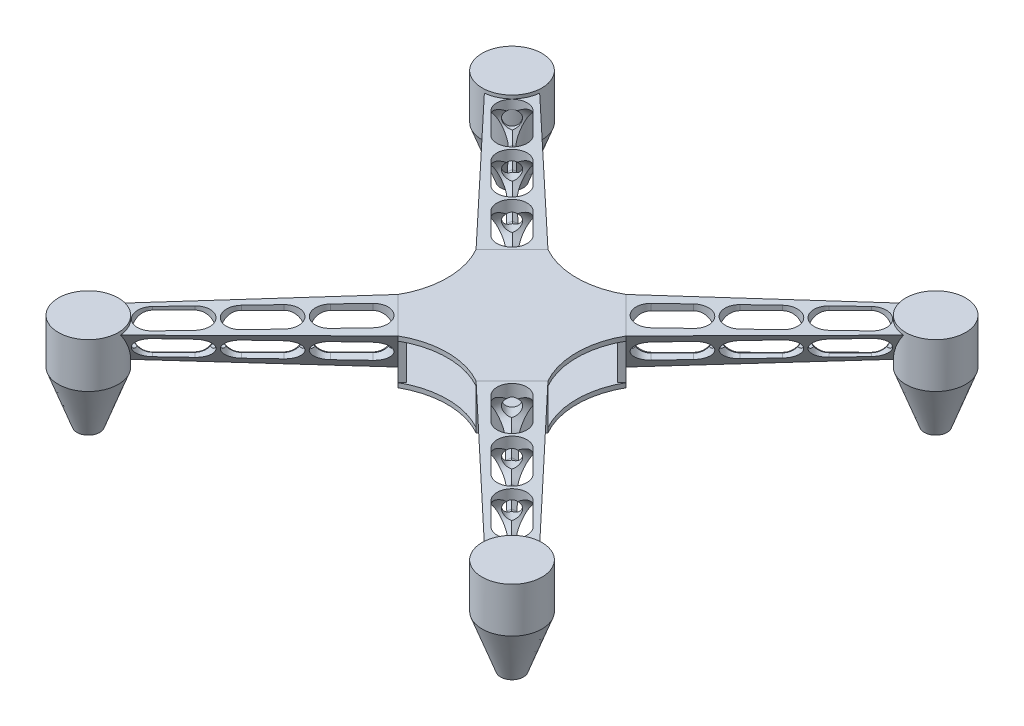
from build123d import *

# Parameters (mm, degrees)
CROQUIS1_R                        = 10
SALIENTE_EXTRUIR1_DEPTH           = 15
CROQUIS1_W                        = 50
CROQUIS1_H                        = 50
SALIENTE_EXTRUIR1_2_DEPTH         = 15
CROQUIS4_W                        = 45
CROQUIS4_H                        = 12
CORTAR_EXTRUIR1_DEPTH             = 200
CROQUIS5_W                        = 45
CROQUIS5_H                        = 12
CORTAR_EXTRUIR2_DEPTH             = 200
CORTAR_EXTRUIR5_DEPTH             = 100
CROQUIS7_W                        = 16.970562748
CROQUIS7_H                        = 15
SALIENTE_EXTRUIR2_DEPTH           = 2
CROQUIS8_W                        = 16.970562748
CROQUIS8_H                        = 15
SALIENTE_EXTRUIR3_DEPTH           = 2
CROQUIS9_W                        = 16.970562748
CROQUIS9_H                        = 15
SALIENTE_EXTRUIR4_DEPTH           = 2
CROQUIS10_W                       = 16.970562748
CROQUIS10_H                       = 15
SALIENTE_EXTRUIR5_DEPTH           = 2
SALIENTE_EXTRUIR6_DEPTH           = 75
SALIENTE_EXTRUIR6_TAPER           = 1
CORTAR_EXTRUIR8_DEPTH             = 5
CORTAR_EXTRUIR9_DEPTH             = 5
CORTAR_EXTRUIR10_DEPTH            = 5
CROQUIS24_R                       = 2.5
CORTAR_EXTRUIR11_DEPTH            = 115
MATRIZC2_COUNT                    = 4
CROQUIS17_R                       = 10
SALIENTE_EXTRUIR7_DEPTH           = 15
CORTAR_EXTRUIR12_DEPTH            = 100
CROQUIS29_R                       = 10
SALIENTE_EXTRUIR9_DEPTH           = 17
SALIENTE_EXTRUIR9_DRAFT           = 20
SALIENTE_EXTRUIR9_PROFILE_2_DEPTH = 17
SALIENTE_EXTRUIR9_PROFILE_2_DRAFT = 20
SALIENTE_EXTRUIR9_PROFILE_3_DEPTH = 17
SALIENTE_EXTRUIR9_PROFILE_3_DRAFT = 20
SALIENTE_EXTRUIR9_PROFILE_4_DEPTH = 17
SALIENTE_EXTRUIR9_PROFILE_4_DRAFT = 20


with BuildPart() as part:
    # Croquis1 → Saliente-Extruir1 (new body)
    with BuildSketch(Plane(origin=(0, 0, 0), x_dir=(1, 0, 0), z_dir=(0, 1, 0))):
        with Locations(Location((-70.710678119, 70.710678119, 0), (0, 0, 270))):
            Circle(CROQUIS1_R)
    extrude(amount=SALIENTE_EXTRUIR1_DEPTH)



with BuildPart() as body_2:
    # Croquis1 → Saliente-Extruir1 2 (new body)
    with BuildSketch(Plane(origin=(0, 0, 0), x_dir=(1, 0, 0), z_dir=(0, 1, 0))):
        Rectangle(CROQUIS1_W, CROQUIS1_H)
    extrude(amount=SALIENTE_EXTRUIR1_2_DEPTH)

    # Croquis4 → Cortar-Extruir1 (cut)
    with BuildSketch(Plane(origin=(25, 0, 0), x_dir=(0, 0, -1), z_dir=(1, 0, 0))):
        with Locations((0, 7.5)):
            Rectangle(CROQUIS4_W, CROQUIS4_H)
    extrude(amount=-CORTAR_EXTRUIR1_DEPTH, mode=Mode.SUBTRACT)

    # Croquis5 → Cortar-Extruir2 (cut)
    with BuildSketch(Plane(origin=(0, 0, -25), x_dir=(-1, 0, 0), z_dir=(0, 0, -1))):
        with Locations((0, 7.5)):
            Rectangle(CROQUIS5_W, CROQUIS5_H)
    extrude(amount=-CORTAR_EXTRUIR2_DEPTH, mode=Mode.SUBTRACT)

    # Croquis6 → Cortar-Extruir5 (cut, symmetric)
    with BuildSketch(Plane(origin=(0, 1.5, 0), x_dir=(1, 0, 0), z_dir=(0, 1, 0))):
        Polygon((-25, 13), (-13, 25), (-25, 25), align=None)
        Polygon((25, -25), (25, -13), (13, -25), align=None)
        Polygon((25, 25), (13, 25), (25, 13), align=None)
        Polygon((-25, -25), (-25, -13), (-13, -25), align=None)
    extrude(amount=CORTAR_EXTRUIR5_DEPTH, both=True, mode=Mode.SUBTRACT)


with BuildPart() as cortar_extruir5_piece_1:
    # of the separate pieces the step leaves, piece 1, a body of its own (cortar_extruir5_pieces)
    add(body_2.part.solids().sort_by_distance((-13, 0, 25))[0])



with BuildPart() as cortar_extruir5_piece_2:
    # of the separate pieces the step leaves, piece 2, a body of its own (cortar_extruir5_pieces)
    add(body_2.part.solids().sort_by_distance((-13, 13.5, 25))[0])


with BuildPart() as cortar_extruir5_piece_1_1:
    add(cortar_extruir5_piece_1.part)

    add(cortar_extruir5_piece_2.part)  # Saliente-Extruir2 merges Cortar-Extruir5 piece 2
    # Croquis7 → Saliente-Extruir2 (add)
    with BuildSketch(Plane(origin=(19, 0, 19), x_dir=(0.7071067811865475, 0, -0.7071067811865477), z_dir=(0.7071067811865477, 0, 0.7071067811865475))):
        with Locations((0, 7.5)):
            Rectangle(CROQUIS7_W, CROQUIS7_H)
    extrude(amount=-SALIENTE_EXTRUIR2_DEPTH)

    # Croquis8 → Saliente-Extruir3 (add)
    with BuildSketch(Plane(origin=(19, 0, -19), x_dir=(-0.7071067811865472, 0, -0.7071067811865478), z_dir=(0.7071067811865478, 0, -0.7071067811865472))):
        with Locations((0, 7.5)):
            Rectangle(CROQUIS8_W, CROQUIS8_H)
    extrude(amount=-SALIENTE_EXTRUIR3_DEPTH)

    # Croquis9 → Saliente-Extruir4 (add)
    with BuildSketch(Plane(origin=(-19, 0, -19), x_dir=(-0.7071067811865475, 0, 0.7071067811865477), z_dir=(-0.7071067811865477, 0, -0.7071067811865475))):
        with Locations((0, 7.5)):
            Rectangle(CROQUIS9_W, CROQUIS9_H)
    extrude(amount=-SALIENTE_EXTRUIR4_DEPTH)

    # Croquis10 → Saliente-Extruir5 (add)
    with BuildSketch(Plane(origin=(-19, 0, 19), x_dir=(0.7071067811865475, 0, 0.7071067811865477), z_dir=(-0.7071067811865477, 0, 0.7071067811865475))):
        with Locations((0, 7.5)):
            Rectangle(CROQUIS10_W, CROQUIS10_H)
    extrude(amount=-SALIENTE_EXTRUIR5_DEPTH)


with BuildPart() as part_1:
    add(part.part)

    add(cortar_extruir5_piece_1_1.part)  # Saliente-Extruir6 merges Cortar-Extruir5 piece 1
    # Croquis11 → Saliente-Extruir6 (add)
    with BuildSketch(Plane(origin=(-19, 0, -19), x_dir=(-0.7071067811865475, 0, 0.7071067811865477), z_dir=(-0.7071067811865477, 0, -0.7071067811865475))):
        Polygon((0, 0), (8.485281374, 15), (-8.485281374, 15), align=None)
    saliente_extruir6 = extrude(amount=SALIENTE_EXTRUIR6_DEPTH, taper=SALIENTE_EXTRUIR6_TAPER)

    # Croquis20 → Cortar-Extruir8 (cut)
    with BuildSketch(Plane(origin=(-0.294360216, -0.230858458, 0.282785929), x_dir=(0.47450033804172476, 0.3721373014234886, 0.7977237981203348), z_dir=(-0.6277044326850748, -0.4922909741961972, 0.6030230028054215))):
        with BuildLine():
            Line((-46.905659661, 26.722264388), (-55.90301314, 31.08662349))
            ThreePointArc((-55.90301314, 31.08662349), (-58.219510329, 37.76747978), (-51.538654038, 40.083976969))
            Line((-51.538654038, 40.083976969), (-42.541300559, 35.719617867))
            ThreePointArc((-42.541300559, 35.719617867), (-40.224803371, 29.038761576), (-46.905659661, 26.722264388))
        make_face()
        with BuildLine():
            Line((-65.780334633, 35.92805847), (-74.777688113, 40.292417572))
            ThreePointArc((-74.777688113, 40.292417572), (-77.094185301, 46.973273863), (-70.413329011, 49.289771051))
            Line((-70.413329011, 49.289771051), (-61.415975531, 44.92541195))
            ThreePointArc((-61.415975531, 44.92541195), (-59.099478343, 38.244555659), (-65.780334633, 35.92805847))
        make_face()
        with BuildLine():
            Line((-28.030984689, 17.516470305), (-37.028338168, 21.880829407))
            ThreePointArc((-37.028338168, 21.880829407), (-39.344835357, 28.561685698), (-32.663979066, 30.878182886))
            Line((-32.663979066, 30.878182886), (-23.666625587, 26.513823784))
            ThreePointArc((-23.666625587, 26.513823784), (-21.350128398, 19.832967494), (-28.030984689, 17.516470305))
        make_face()
    cortar_extruir8 = extrude(amount=-CORTAR_EXTRUIR8_DEPTH, mode=Mode.SUBTRACT)

    # Croquis21 → Cortar-Extruir9 (cut)
    with BuildSketch(Plane(origin=(0.282785929, -0.230858458, -0.294360216), x_dir=(-0.7977237981203357, -0.3721373014234891, -0.47450033804172287), z_dir=(0.6030230028054204, -0.49229097419619955, -0.6277044326850743))):
        with BuildLine():
            Line((36.989503564, 21.962448925), (27.992150085, 17.598089824))
            ThreePointArc((27.992150085, 17.598089824), (21.311293794, 19.914587012), (23.627790983, 26.595443303))
            Line((23.627790983, 26.595443303), (32.625144462, 30.959802405))
            ThreePointArc((32.625144462, 30.959802405), (39.306000753, 28.643305216), (36.989503564, 21.962448925))
        make_face()
        with BuildLine():
            Line((55.864138803, 31.168223629), (46.866785324, 26.803864527))
            ThreePointArc((46.866785324, 26.803864527), (40.185929034, 29.120361716), (42.502426222, 35.801218006))
            Line((42.502426222, 35.801218006), (51.499779701, 40.165577108))
            ThreePointArc((51.499779701, 40.165577108), (58.180635992, 37.84907992), (55.864138803, 31.168223629))
        make_face()
        with BuildLine():
            Line((74.738774043, 40.373998333), (65.741420564, 36.009639231))
            ThreePointArc((65.741420564, 36.009639231), (59.060564273, 38.326136419), (61.377061462, 45.00699271))
            Line((61.377061462, 45.00699271), (70.374414941, 49.371351812))
            ThreePointArc((70.374414941, 49.371351812), (77.055271231, 47.054854623), (74.738774043, 40.373998333))
        make_face()
    cortar_extruir9 = extrude(amount=-CORTAR_EXTRUIR9_DEPTH, mode=Mode.SUBTRACT)

    # Croquis22 → Cortar-Extruir10 (cut)
    with BuildSketch(Plane(origin=(-0.190869674, 15.464306947, -0.190869674), x_dir=(0.9999238504780121, 0.012339775057140063, -0.00015230484316707172), z_dir=(-0.012340714939826953, 0.9998476951563913, -0.012340714939826948))):
        with BuildLine():
            Line((-26.58868346, 19.521127269), (-33.659212731, 26.59273358))
            ThreePointArc((-33.659212731, 26.59273358), (-33.658674211, 33.663801371), (-26.58760642, 33.663262851))
            Line((-26.58760642, 33.663262851), (-19.517077148, 26.59165654))
            ThreePointArc((-19.517077148, 26.59165654), (-19.517615668, 19.520588749), (-26.58868346, 19.521127269))
        make_face()
        with BuildLine():
            Line((-34.366319559, 41.440898951), (-41.436848831, 48.512505262))
            ThreePointArc((-41.436848831, 48.512505262), (-48.507916622, 48.513043782), (-48.508455142, 41.441975991))
            Line((-48.508455142, 41.441975991), (-41.437925871, 34.37036968))
            ThreePointArc((-41.437925871, 34.37036968), (-34.366858079, 34.36983116), (-34.366319559, 41.440898951))
        make_face()
        with BuildLine():
            Line((-49.215561971, 56.290141362), (-56.286091242, 63.361747673))
            ThreePointArc((-56.286091242, 63.361747673), (-63.357159033, 63.362286193), (-63.357697553, 56.291218402))
            Line((-63.357697553, 56.291218402), (-56.287168282, 49.219612091))
            ThreePointArc((-56.287168282, 49.219612091), (-49.21610049, 49.219073571), (-49.215561971, 56.290141362))
        make_face()
    cortar_extruir10 = extrude(amount=-CORTAR_EXTRUIR10_DEPTH, mode=Mode.SUBTRACT)

    # Croquis24 → Cortar-Extruir11 (cut)
    with BuildSketch(Plane(origin=(-17.585786438, 0, -17.585786438), x_dir=(0.7071067811865474, 0, -0.7071067811865477), z_dir=(0.7071067811865477, 0, 0.7071067811865474))):
        with Locations(Location((0, 8.5, 0), (0, 0, 59.530931729))):
            Circle(CROQUIS24_R)
    cortar_extruir11 = extrude(amount=-CORTAR_EXTRUIR11_DEPTH, mode=Mode.SUBTRACT)

    # MatrizC2: Saliente-Extruir6, Cortar-Extruir8, Cortar-Extruir9, Cortar-Extruir10, Cortar-Extruir11 ×4 about axis
    matrizc2_axis = Axis((0, 0, 0), (0, 1, 0))
    add([saliente_extruir6.rotate(matrizc2_axis, i * 360 / MATRIZC2_COUNT) for i in range(1, MATRIZC2_COUNT)])
    add([cortar_extruir8.rotate(matrizc2_axis, i * 360 / MATRIZC2_COUNT) for i in range(1, MATRIZC2_COUNT)], mode=Mode.SUBTRACT)
    add([cortar_extruir9.rotate(matrizc2_axis, i * 360 / MATRIZC2_COUNT) for i in range(1, MATRIZC2_COUNT)], mode=Mode.SUBTRACT)
    add([cortar_extruir10.rotate(matrizc2_axis, i * 360 / MATRIZC2_COUNT) for i in range(1, MATRIZC2_COUNT)], mode=Mode.SUBTRACT)
    add([cortar_extruir11.rotate(matrizc2_axis, i * 360 / MATRIZC2_COUNT) for i in range(1, MATRIZC2_COUNT)], mode=Mode.SUBTRACT)

    # Croquis17 → Saliente-Extruir7 (add)
    with BuildSketch(Plane(origin=(0, 0, 0), x_dir=(1, 0, 0), z_dir=(0, 1, 0))):
        with Locations(Location((70.710678119, 70.710678119, 0), (0, 0, 270))):
            Circle(CROQUIS17_R)
        with Locations(Location((-70.710678119, 70.710678119, 0), (0, 0, 270))):
            Circle(CROQUIS17_R)
        with Locations(Location((70.710678119, -70.710678119, 0), (0, 0, 270))):
            Circle(CROQUIS17_R)
        with Locations(Location((-70.710678119, -70.710678119, 0), (0, 0, 270))):
            Circle(CROQUIS17_R)
    extrude(amount=SALIENTE_EXTRUIR7_DEPTH)

    # Croquis27 → Cortar-Extruir12 (cut)
    with BuildSketch(Plane(origin=(0, 15, 0), x_dir=(1, 0, 0), z_dir=(0, 1, 0))):
        with BuildLine():
            Line((-13, 25), (13, 25))
            ThreePointArc((13, 25), (0, 21.576441697), (-13, 25))
        make_face()
        with BuildLine():
            Line((25, 13), (25, -13))
            ThreePointArc((25, -13), (21.576441697, 0), (25, 13))
        make_face()
        with BuildLine():
            Line((13, -25), (-13, -25))
            ThreePointArc((-13, -25), (0, -21.576441697), (13, -25))
        make_face()
        with BuildLine():
            Line((-25, -13), (-25, 13))
            ThreePointArc((-25, 13), (-21.576441697, 0), (-25, -13))
        make_face()
    extrude(amount=-CORTAR_EXTRUIR12_DEPTH, mode=Mode.SUBTRACT)


with BuildPart() as saliente_extruir9_tool:
    # Croquis29 → Saliente-Extruir9 (with draft: the straight prism first)
    with BuildSketch(Plane.XZ):
        with Locations(Location((-70.710678119, 70.710678119, 0), (0, 0, 270))):
            Circle(CROQUIS29_R)
    extrude(amount=SALIENTE_EXTRUIR9_DEPTH)
    # Saliente-Extruir9: the draft: its side faces are tilted about the plane it starts from
    saliente_extruir9_sides = [saliente_extruir9_tool.faces().sort_by_distance(p)[0] for p in [
        (-70.710678119, -8.5, 80.710678119),
    ]]
    draft(saliente_extruir9_sides, Plane.XZ, SALIENTE_EXTRUIR9_DRAFT)


with BuildPart() as part_2:
    add(part_1.part)

    # Saliente-Extruir9: add saliente_extruir9_tool
    add(saliente_extruir9_tool.part)


with BuildPart() as saliente_extruir9_profile_2_tool:
    # Croquis29 → Saliente-Extruir9 profile 2 (with draft: the straight prism first)
    with BuildSketch(Plane.XZ):
        with Locations(Location((70.710678119, 70.710678119, 0), (0, 0, 270))):
            Circle(CROQUIS29_R)
    extrude(amount=SALIENTE_EXTRUIR9_PROFILE_2_DEPTH)
    # Saliente-Extruir9 profile 2: the draft: its side faces are tilted about the plane it starts from
    saliente_extruir9_profile_2_sides = [saliente_extruir9_profile_2_tool.faces().sort_by_distance(p)[0] for p in [
        (70.710678119, -8.5, 80.710678119),
    ]]
    draft(saliente_extruir9_profile_2_sides, Plane.XZ, SALIENTE_EXTRUIR9_PROFILE_2_DRAFT)


with BuildPart() as part_3:
    add(part_2.part)

    # Saliente-Extruir9 profile 2: add saliente_extruir9_profile_2_tool
    add(saliente_extruir9_profile_2_tool.part)


with BuildPart() as saliente_extruir9_profile_3_tool:
    # Croquis29 → Saliente-Extruir9 profile 3 (with draft: the straight prism first)
    with BuildSketch(Plane.XZ):
        with Locations(Location((70.710678119, -70.710678119, 0), (0, 0, 270))):
            Circle(CROQUIS29_R)
    extrude(amount=SALIENTE_EXTRUIR9_PROFILE_3_DEPTH)
    # Saliente-Extruir9 profile 3: the draft: its side faces are tilted about the plane it starts from
    saliente_extruir9_profile_3_sides = [saliente_extruir9_profile_3_tool.faces().sort_by_distance(p)[0] for p in [
        (70.710678119, -8.5, -60.710678119),
    ]]
    draft(saliente_extruir9_profile_3_sides, Plane.XZ, SALIENTE_EXTRUIR9_PROFILE_3_DRAFT)


with BuildPart() as part_4:
    add(part_3.part)

    # Saliente-Extruir9 profile 3: add saliente_extruir9_profile_3_tool
    add(saliente_extruir9_profile_3_tool.part)


with BuildPart() as saliente_extruir9_profile_4_tool:
    # Croquis29 → Saliente-Extruir9 profile 4 (with draft: the straight prism first)
    with BuildSketch(Plane.XZ):
        with Locations(Location((-70.710678119, -70.710678119, 0), (0, 0, 270))):
            Circle(CROQUIS29_R)
    extrude(amount=SALIENTE_EXTRUIR9_PROFILE_4_DEPTH)
    # Saliente-Extruir9 profile 4: the draft: its side faces are tilted about the plane it starts from
    saliente_extruir9_profile_4_sides = [saliente_extruir9_profile_4_tool.faces().sort_by_distance(p)[0] for p in [
        (-70.710678119, -8.5, -60.710678119),
    ]]
    draft(saliente_extruir9_profile_4_sides, Plane.XZ, SALIENTE_EXTRUIR9_PROFILE_4_DRAFT)


with BuildPart() as part_5:
    add(part_4.part)

    # Saliente-Extruir9 profile 4: add saliente_extruir9_profile_4_tool
    add(saliente_extruir9_profile_4_tool.part)


solid = part_5.part
